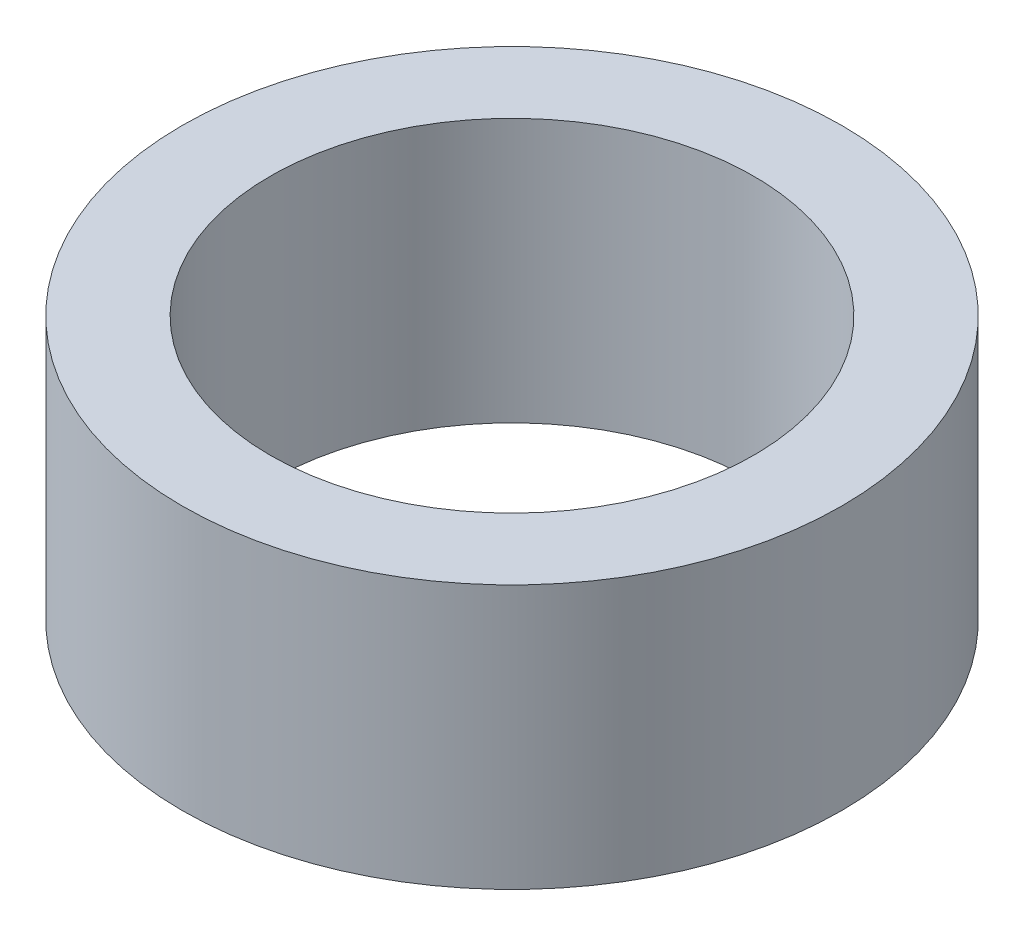
from build123d import *

# Parameters (mm, degrees)
SKETCH1_R           = 37.5
BOSS_EXTRUDE1_DEPTH = 30
SKETCH2_R           = 27.5
CUT_EXTRUDE1_DEPTH  = 61.930288035


with BuildPart() as part:
    # Sketch1 → Boss-Extrude1 (new body)
    with BuildSketch(Plane(origin=(0, 0, 0), x_dir=(1, 0, 0), z_dir=(0, 1, 0))):
        Circle(SKETCH1_R)
    extrude(amount=BOSS_EXTRUDE1_DEPTH)

    # Sketch2 → Cut-Extrude1 (cut, through all)
    with BuildSketch(Plane(origin=(0, 0, 0), x_dir=(1, 0, 0), z_dir=(0, 1, 0))):
        Circle(SKETCH2_R)
    extrude(amount=CUT_EXTRUDE1_DEPTH, mode=Mode.SUBTRACT)


solid = part.part
